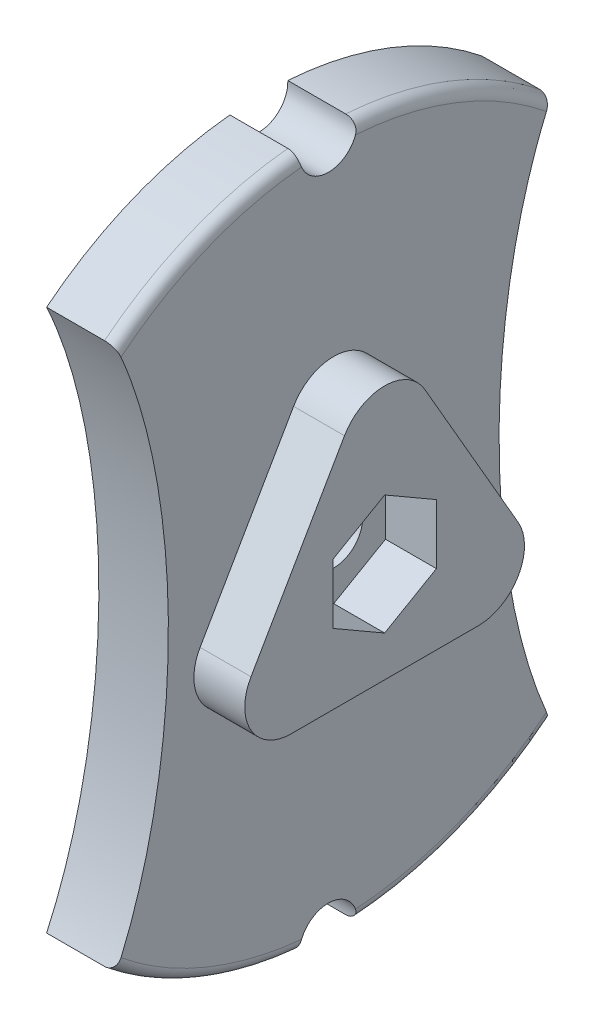
from build123d import *

# Parameters (mm, degrees)
SKETCH2_R           = 3.175
BOSS_EXTRUDE1_DEPTH = 7.62
BOSS_EXTRUDE2_DEPTH = 5.58
FILLET1_R           = 5.08
FILLET3_R           = 1.27
SKETCH4_RX          = 42.376376882
SKETCH4_RY          = 19.974607039
CUT_EXTRUDE1_DEPTH  = 56.414672328


with BuildPart() as part:
    # Sketch2 → Boss-Extrude1 (new body)
    with BuildSketch(Plane(origin=(0, 0, 0), x_dir=(0, 0, -1), z_dir=(1, 0, 0))):
        with BuildLine():
            ThreePointArc((2.583429114, -38.0123124), (38.1, 0), (2.583429114, 38.0123124))
            ThreePointArc((2.583429114, 38.0123124), (-0.538729322, 34.687864027), (-3.762619561, 37.913753363))
            ThreePointArc((-3.762619561, 37.913753363), (-38.1, 0), (-3.762619561, -37.913753363))
            ThreePointArc((-3.762619561, -37.913753363), (-0.538729322, -34.687864027), (2.583429114, -38.0123124))
        make_face()
        Circle(SKETCH2_R, mode=Mode.SUBTRACT)
    extrude(amount=BOSS_EXTRUDE1_DEPTH)

    # Sketch3 → Boss-Extrude2 (add)
    with BuildSketch(Plane(origin=(7.62, 0, 0), x_dir=(0, 0, -1), z_dir=(1, 0, 0))):
        Polygon((19.05, -10.998522628), (0, 21.997045256), (-19.05, -10.998522628), align=None)
        Polygon((-5.675, 3.276462778), (-5.675, -3.276462778), (0, -6.552925555), (5.675, -3.276462778), (5.675, 3.276462778), (0, 6.552925555), align=None, mode=Mode.SUBTRACT)
    extrude(amount=BOSS_EXTRUDE2_DEPTH)

    # Fillet1
    fillet1_edges = [part.edges().sort_by_distance(p)[0] for p in [
        (10.41, -10.998522628, -19.05),
        (10.41, 21.997045256, 0),
        (10.41, -10.998522628, 19.05),
    ]]
    fillet(fillet1_edges, radius=FILLET1_R)

    # Fillet3
    fillet3_edges = [part.edges().sort_by_distance(p)[0] for p in [
        (7.62, 0, -38.1),
        (7.62, 0, 38.1),
    ]]
    fillet(fillet3_edges, radius=FILLET3_R)

    # Sketch4 → Cut-Extrude1 (cut, through all)
    with BuildSketch(Plane.ZY):
        with Locations(Location((-38.1, 0), (0, 0, -90))):
            Ellipse(SKETCH4_RX, SKETCH4_RY)
    cut_extrude1 = extrude(amount=-CUT_EXTRUDE1_DEPTH, mode=Mode.SUBTRACT)

    # Mirror1: Cut-Extrude1 across plane
    add(cut_extrude1.mirror(Plane.XY), mode=Mode.SUBTRACT)


solid = part.part
